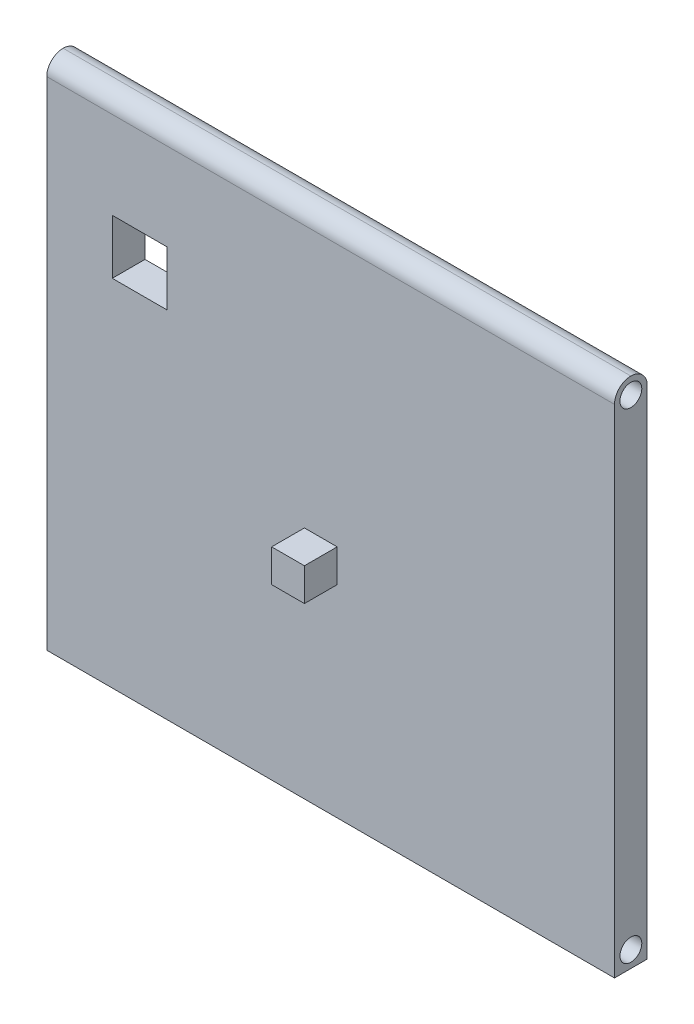
from build123d import *

# Parameters (mm, degrees)
SKETCH_1_W          = 52
SKETCH_1_H          = 47
EXTRUDE_1_DEPTH     = 3
SKETCH_2_R          = 1
CUT_EXTRUDE_1_DEPTH = 92
FILLET_1_R          = 1.5
FILLET_2_R          = 1.5
SKETCH_3_R          = 1
CUT_EXTRUDE_2_DEPTH = 92
SKETCH_4_W          = 3
SKETCH_4_H          = 3
EXTRUDE_2_DEPTH     = 3
SKETCH_5_W          = 5
SKETCH_5_H          = 5
CUT_EXTRUDE_3_DEPTH = 6


with BuildPart() as part:
    # 草图1 → 凸台-拉伸1 (new body)
    with BuildSketch(Plane.XY):
        with Locations((9.526717557, -16.255725191)):
            Rectangle(SKETCH_1_W, SKETCH_1_H)
    extrude(amount=EXTRUDE_1_DEPTH)

    # 草图2 → 切除-拉伸1 (cut)
    with BuildSketch(Plane(origin=(35.526717557, 0, 0), x_dir=(0, 0, -1), z_dir=(1, 0, 0))):
        with Locations(Location((-1.5, 5.744274809, 0), (0, 0, 90))):
            Circle(SKETCH_2_R)
    extrude(amount=-CUT_EXTRUDE_1_DEPTH, mode=Mode.SUBTRACT)

    # 圆角1
    fillet_1_edges = [part.edges().sort_by_distance(p)[0] for p in [
        (9.526717557, 7.244274809, 0),
    ]]
    fillet(fillet_1_edges, radius=FILLET_1_R)

    # 圆角2
    fillet_2_edges = [part.edges().sort_by_distance(p)[0] for p in [
        (9.526717557, 7.244274809, 3),
    ]]
    fillet(fillet_2_edges, radius=FILLET_2_R - 0.0001)  # a hair under: the kernel refuses the full size

    # 草图3 → 切除-拉伸2 (cut)
    with BuildSketch(Plane(origin=(35.526717557, 0, 0), x_dir=(0, 0, -1), z_dir=(1, 0, 0))):
        with Locations(Location((-1.5, -38.255725191, 0), (0, 0, 90))):
            Circle(SKETCH_3_R)
    extrude(amount=-CUT_EXTRUDE_2_DEPTH, mode=Mode.SUBTRACT)

    # 草图4 → 凸台-拉伸2 (add)
    with BuildSketch(Plane.XY.offset(3)):
        with Locations((8.626717557, -19.755725191)):
            Rectangle(SKETCH_4_W, SKETCH_4_H)
    extrude(amount=EXTRUDE_2_DEPTH)

    # 草图5 → 切除-拉伸3 (cut)
    with BuildSketch(Plane(origin=(0, 0, 0), x_dir=(-1, 0, 0), z_dir=(0, 0, -1))):
        with Locations((7.973282443, -4.755725191)):
            Rectangle(SKETCH_5_W, SKETCH_5_H)
    extrude(amount=-CUT_EXTRUDE_3_DEPTH, mode=Mode.SUBTRACT)


solid = part.part
